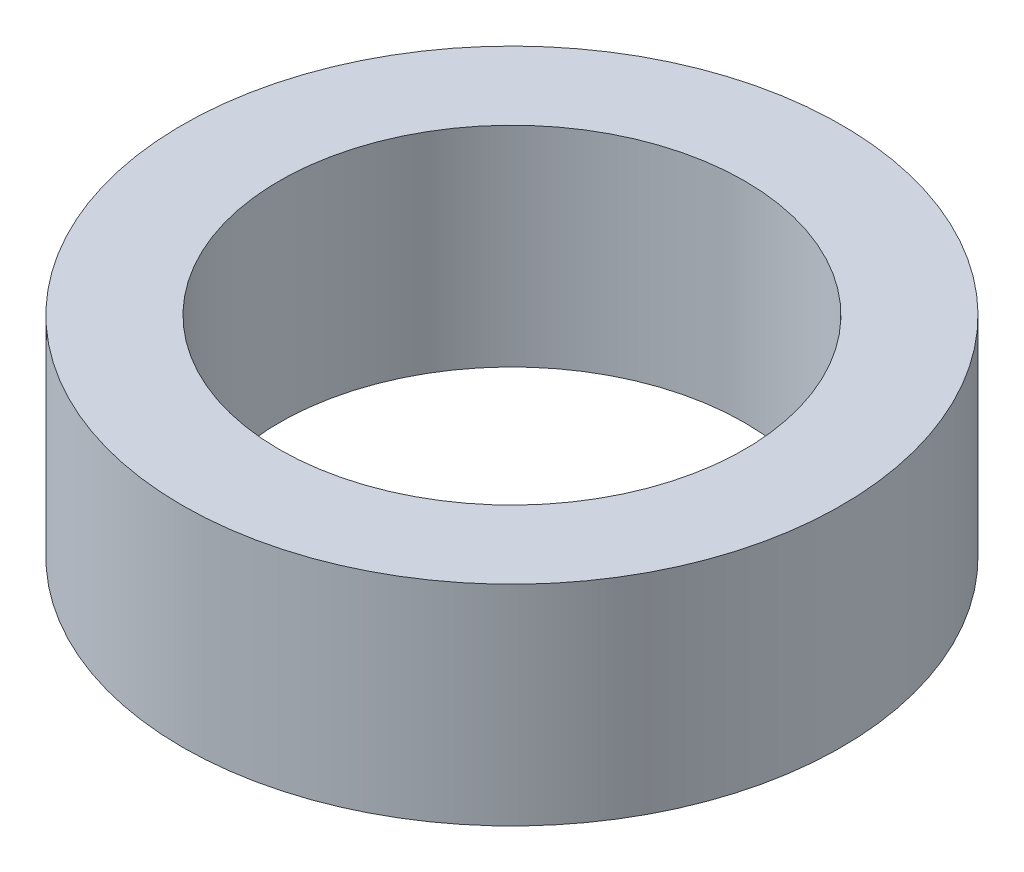
from build123d import *

# Parameters (mm, degrees)
SKETCH1_R           = 42.5
BOSS_EXTRUDE1_DEPTH = 27
SKETCH2_R           = 30
CUT_EXTRUDE1_DEPTH  = 66.890059948


with BuildPart() as part:
    # Sketch1 → Boss-Extrude1 (new body)
    with BuildSketch(Plane(origin=(0, 0, 0), x_dir=(1, 0, 0), z_dir=(0, 1, 0))):
        Circle(SKETCH1_R)
    extrude(amount=BOSS_EXTRUDE1_DEPTH)

    # Sketch2 → Cut-Extrude1 (cut, through all)
    with BuildSketch(Plane(origin=(0, 0, 0), x_dir=(1, 0, 0), z_dir=(0, 1, 0))):
        Circle(SKETCH2_R)
    extrude(amount=CUT_EXTRUDE1_DEPTH, mode=Mode.SUBTRACT)


solid = part.part
